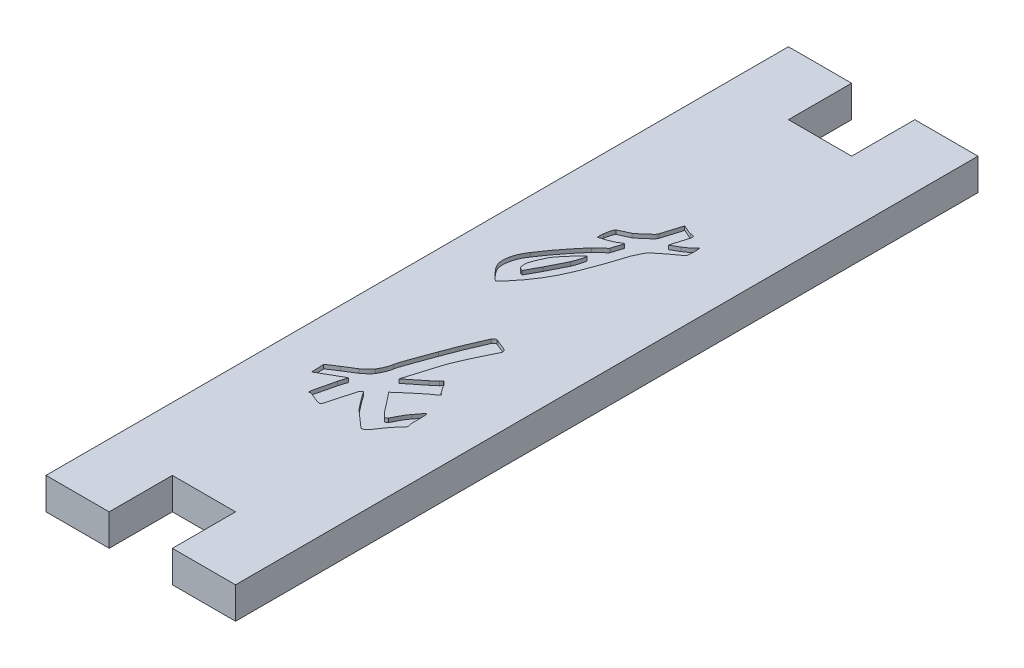
from build123d import *

# Parameters (mm, degrees)
EXTRUDE_1_DEPTH     = 4
CUT_EXTRUDE_1_DEPTH = 0.5


with BuildPart() as part:
    # 草圖1 → 填料-伸長1 (new body)
    with BuildSketch(Plane(origin=(0, 0, 0), x_dir=(1, 0, 0), z_dir=(0, 1, 0))):
        Polygon((-12, 47), (-12, -47), (-4, -47), (-4, -39), (4, -39), (4, -47), (12, -47), (12, 47), (4, 47), (4, 39), (-4, 39), (-4, 47), align=None)
    extrude(amount=EXTRUDE_1_DEPTH)

    # 草圖3 → 除料-伸長1 (cut)
    # profile 1 of 2: a face of its own
    with BuildSketch(Plane(origin=(0, 4, 0), x_dir=(1, 0, 0), z_dir=(0, 1, 0))):
        with BuildLine():
            add(Edge.make_bspline(
                [(-6.355501814, 4.359129383), (-6.396964695, 4.429641782), (-6.490705603, 4.589058979), (-6.607213892, 4.87628821), (-6.682323732, 5.240280014), (-6.686608044, 5.589572198), (-6.659611427, 5.899764075), (-6.613103157, 6.159630598), (-6.552451609, 6.438590561), (-6.468428857, 6.737134296), (-6.357637131, 7.056471783), (-6.197448135, 7.386617717), (-6.009152613, 7.740262462), (-5.857995764, 7.973302873), (-5.778718259, 8.095525998)],
                knots=[0, 0, 0, 0, 0.737570712, 1.667528793, 2.782379236, 4.070236944, 4.804167307, 5.589800716, 6.450142315, 7.379332046, 8.387006106, 9.495001798, 10.686199072, 12, 12, 12, 12], degree=3))
            add(Edge.make_bspline(
                [(-5.778718259, 8.095525998), (-5.614963707, 8.345918195), (-5.284236811, 8.851622817), (-4.756748484, 9.581410264), (-4.229891658, 10.274440351), (-3.802282785, 10.816175608), (-3.482573731, 11.212484586), (-3.259201189, 11.474774792), (-3.061985835, 11.720543896), (-2.877170248, 11.934111647), (-2.720280366, 12.121611227), (-2.589574808, 12.272839433), (-2.491294281, 12.388657066), (-2.437652714, 12.454594134), (-2.415961306, 12.481257557)],
                knots=[0, 0, 0, 0, 1.947119918, 3.932500911, 5.859217176, 7.613267125, 8.424533951, 9.173261026, 9.855497357, 10.475266734, 11.01138208, 11.446753545, 11.776279939, 12, 12, 12, 12], degree=3))
            add(Edge.make_bspline(
                [(-2.415961306, 12.481257557), (-2.375673558, 12.528002754), (-2.283400562, 12.635065557), (-2.111086984, 12.789836765), (-1.916511164, 12.958858232), (-1.718707164, 13.132049105), (-1.530781981, 13.294723678), (-1.368397809, 13.435913814), (-1.232778151, 13.541823636), (-1.201260404, 13.628733679), (-1.189842805, 13.660217654)],
                knots=[0, 0, 0, 0, 0.865178994, 1.981561663, 3.244134827, 4.482766419, 5.673521409, 6.720709703, 7.536565132, 8, 8, 8, 8], degree=3))
            add(Edge.make_bspline(
                [(-1.189842805, 13.660217654), (-1.178801259, 13.692814769), (-1.151929216, 13.772147048), (-1.110851983, 13.909196174), (-1.061598309, 14.072176342), (-1.012205552, 14.249481274), (-0.959481422, 14.426572001), (-0.904971769, 14.591590611), (-0.849019562, 14.72547937), (-0.823083673, 14.806394462), (-0.812575574, 14.839177751)],
                knots=[0, 0, 0, 0, 0.666986064, 1.62325791, 2.772553635, 3.966844816, 5.190213908, 6.353757644, 7.333013936, 8, 8, 8, 8], degree=3))
            add(Edge.make_bspline(
                [(-0.812575574, 14.839177751), (-0.800655951, 14.872439462), (-0.780708314, 14.928103344), (-0.767234849, 15.025221683), (-0.846806913, 15.043046994), (-0.932610841, 14.985166609), (-1.071759688, 14.906725782), (-1.178284056, 14.832079469), (-1.240628779, 14.788391778)],
                knots=[0, 0, 0, 0, 0.954507045, 1.597379236, 1.915548251, 2.736114477, 4.089770055, 6, 6, 6, 6], degree=3))
            add(Edge.make_bspline(
                [(-1.240628779, 14.788391778), (-1.327580877, 14.731628596), (-1.506171083, 14.615043161), (-1.802148162, 14.483408633), (-2.109435492, 14.372118835), (-2.405791492, 14.263409521), (-2.680379731, 14.17651472), (-2.910767377, 14.103183989), (-3.087990448, 14.056261978), (-3.183887737, 14.024483527), (-3.221281741, 14.012091898)],
                knots=[0, 0, 0, 0, 1.165451177, 2.39371069, 3.62804535, 4.840260365, 5.940495452, 6.864742646, 7.557319936, 8, 8, 8, 8], degree=3))
            add(Edge.make_bspline(
                [(-3.221281741, 14.012091898), (-3.22534503, 14.143989053), (-3.233333674, 14.403305985), (-3.208225891, 14.661515935), (-3.195888755, 14.788391778)],
                knots=[0, 0, 0, 0, 1.01726604, 2, 2, 2, 2], degree=3))
            add(Edge.make_bspline(
                [(-3.195888755, 14.788391778), (-3.177074742, 14.897349007), (-3.13932888, 15.115945898), (-3.074192657, 15.435897913), (-2.99026329, 15.737230253), (-2.890925619, 15.910785383), (-2.84401451, 15.992744861)],
                knots=[0, 0, 0, 0, 1.050103717, 2.106784545, 3.105950083, 4, 4, 4, 4], degree=3))
            Line((-2.84401451, 15.992744861), (-1.440145103, 16.645707376))
            add(Edge.make_bspline(
                [(-1.440145103, 16.645707376), (-1.387014209, 16.686917319), (-1.258206121, 16.786824805), (-1.03600765, 16.95451716), (-0.772139069, 17.159164741), (-0.49982224, 17.396656781), (-0.229031634, 17.636599328), (0.014427265, 17.868413205), (0.215397355, 18.077474031), (0.285876649, 18.233908803), (0.315598549, 18.299879081)],
                knots=[0, 0, 0, 0, 0.663792019, 1.609266752, 2.748404141, 3.959042503, 5.176430326, 6.316255543, 7.289946295, 8, 8, 8, 8], degree=3))
            add(Edge.make_bspline(
                [(0.315598549, 18.299879081), (0.325050002, 18.333803159), (0.346409026, 18.410467052), (0.387713096, 18.53664313), (0.434204695, 18.690792698), (0.512295263, 18.932418037), (0.618930546, 19.255254025), (0.737907516, 19.648410199), (0.855311078, 20.022846047), (0.94552102, 20.31282673), (1.005149303, 20.512612015), (1.03836806, 20.623344095), (1.057994607, 20.700857063), (1.064250583, 20.741202013), (1.066505441, 20.755743652)],
                knots=[0, 0, 0, 0, 0.493483248, 1.115206369, 1.86026494, 2.749904517, 4.67381163, 6.624917053, 8.506259925, 10.173295465, 10.880993075, 11.428019552, 11.793839554, 12, 12, 12, 12], degree=3))
            add(Edge.make_bspline(
                [(1.066505441, 20.755743652), (1.078394603, 20.764624321), (1.123491516, 20.798309688), (1.236800829, 20.721551605), (1.383100762, 20.67505288), (1.56203513, 20.588996971), (1.751209944, 20.502808464), (1.936868916, 20.40476984), (2.109745793, 20.328465436), (2.223228075, 20.312588747), (2.270858525, 20.30592503)],
                knots=[0, 0, 0, 0, 0.259029242, 0.982526738, 2.06748882, 3.260521251, 4.562127083, 5.903125012, 7.119905784, 8, 8, 8, 8], degree=3))
            add(Edge.make_bspline(
                [(2.270858525, 20.30592503), (2.307027401, 20.298908891), (2.381325741, 20.284496292), (2.495894074, 20.281269505), (2.60754941, 20.273850249), (2.708123952, 20.247672393), (2.792873311, 20.189554354), (2.833073243, 20.078147149), (2.825147792, 19.919523124), (2.791727394, 19.801004556), (2.77146312, 19.729141475)],
                knots=[0, 0, 0, 0, 0.876416554, 1.800340585, 2.726508788, 3.537985945, 4.258395915, 5.071917099, 6.224573051, 8, 8, 8, 8], degree=3))
            add(Edge.make_bspline(
                [(2.77146312, 19.729141475), (2.738216951, 19.631388811), (2.6675251, 19.423535785), (2.570805342, 19.09827322), (2.471393346, 18.760639468), (2.405059605, 18.534468476), (2.372430472, 18.423216445)],
                knots=[0, 0, 0, 0, 0.907183319, 1.928958154, 2.981268062, 4, 4, 4, 4], degree=3))
            add(Edge.make_bspline(
                [(2.372430472, 18.423216445), (2.338121909, 18.296032144), (2.267944258, 18.035878562), (2.188252887, 17.778478482), (2.147521161, 17.646916566)],
                knots=[0, 0, 0, 0, 0.977763209, 2, 2, 2, 2], degree=3))
            add(Edge.make_bspline(
                [(2.147521161, 17.646916566), (2.323575928, 17.743608954), (2.661240682, 17.929060403), (2.990935068, 18.12832834), (3.148730351, 18.223700121)],
                knots=[0, 0, 0, 0, 1.042778462, 2, 2, 2, 2], degree=3))
            add(Edge.make_bspline(
                [(3.148730351, 18.223700121), (3.279099193, 18.306896722), (3.532031814, 18.468309019), (3.827878365, 18.685784426), (4.041194803, 18.855328752), (4.169839866, 18.977646376), (4.275129682, 19.090159134), (4.328466604, 19.167464705), (4.353083434, 19.203143894)],
                knots=[0, 0, 0, 0, 1.781606563, 3.456549942, 4.229084896, 4.919048909, 5.501103773, 6, 6, 6, 6], degree=3))
            add(Edge.make_bspline(
                [(4.353083434, 19.203143894), (4.365584965, 19.226966086), (4.384919812, 19.263809451), (4.441194248, 19.316120282), (4.480751486, 19.253591234), (4.49918412, 19.138425127), (4.527846222, 18.916669042), (4.528014888, 18.616072783), (4.523019604, 18.283613598), (4.5045242, 18.01242126), (4.495477891, 17.818915499), (4.476010226, 17.719028044), (4.472755816, 17.654202047), (4.458613172, 17.628668963), (4.454655381, 17.621523579)],
                knots=[0, 0, 0, 0, 0.565973437, 0.875333592, 1.161042589, 1.702097804, 3.326650178, 5.415151342, 7.645979144, 9.832069873, 10.760150337, 11.431246737, 11.840835513, 12, 12, 12, 12], degree=3))
            add(Edge.make_bspline(
                [(4.454655381, 17.621523579), (4.227892611, 17.460376924), (3.78900439, 17.148485475), (3.357356414, 16.826650909), (3.148730351, 16.671100363)],
                knots=[0, 0, 0, 0, 1.033350906, 2, 2, 2, 2], degree=3))
            add(Edge.make_bspline(
                [(3.148730351, 16.671100363), (2.984829608, 16.547396061), (2.662950134, 16.304457104), (2.280417729, 15.996859971), (2.003015275, 15.7725801), (1.843084807, 15.631282794), (1.725014504, 15.517538078), (1.666987359, 15.445416041), (1.643288996, 15.415961306)],
                knots=[0, 0, 0, 0, 1.88241189, 3.696809041, 4.500195613, 5.151991927, 5.653672387, 6, 6, 6, 6], degree=3))
            add(Edge.make_bspline(
                [(1.643288996, 15.415961306), (1.567888193, 15.28800753), (1.406365118, 15.013905842), (1.284069825, 14.720123748), (1.218863362, 14.563482467)],
                knots=[0, 0, 0, 0, 0.933622674, 2, 2, 2, 2], degree=3))
            add(Edge.make_bspline(
                [(1.218863362, 14.563482467), (1.176651309, 14.473950261), (1.093845672, 14.298318637), (1.009774868, 14.12328913), (0.968561064, 14.037484885)],
                knots=[0, 0, 0, 0, 1.019545377, 2, 2, 2, 2], degree=3))
            add(Edge.make_bspline(
                [(0.968561064, 14.037484885), (0.849535813, 13.649931707), (0.609597883, 12.868679776), (0.346573374, 12.094893992), (0.214026602, 11.704957678)],
                knots=[0, 0, 0, 0, 0.992133686, 2, 2, 2, 2], degree=3))
            add(Edge.make_bspline(
                [(0.214026602, 11.704957678), (0.090993183, 11.356147322), (-0.165465463, 10.629064939), (-0.586767093, 9.531147171), (-1.02727134, 8.424166151), (-1.370786044, 7.712829738), (-1.53808948, 7.366384522)],
                knots=[0, 0, 0, 0, 0.94794649, 1.975959659, 3.014222975, 4, 4, 4, 4], degree=3))
            add(Edge.make_bspline(
                [(-1.53808948, 7.366384522), (-1.706491203, 7.043403536), (-2.035186776, 6.412991816), (-2.50249307, 5.674043667), (-2.878157375, 5.127060114), (-3.1445816, 4.751525298), (-3.402408942, 4.404780452), (-3.652005084, 4.092565304), (-3.884548983, 3.807649108), (-4.100042025, 3.556253816), (-4.297710464, 3.335420527), (-4.474764512, 3.150800648), (-4.62539466, 3.004800044), (-4.738038152, 2.897753476), (-4.815312887, 2.830715332), (-4.860685257, 2.809731918), (-4.875453446, 2.802902056)],
                knots=[0, 0, 0, 0, 2.68881243, 5.248169221, 6.44938883, 7.589130221, 8.648150866, 9.639668993, 10.540603059, 11.363847075, 12.084638577, 12.728789694, 13.252889179, 13.631939189, 13.880200399, 14, 14, 14, 14], degree=3))
            add(Edge.make_bspline(
                [(-4.875453446, 2.802902056), (-4.887759621, 2.806013638), (-4.919072047, 2.813930899), (-4.971174126, 2.848356063), (-5.043204711, 2.897877043), (-5.167730755, 2.9999646), (-5.345068535, 3.157591897), (-5.560553246, 3.383146756), (-5.778697744, 3.634841778), (-6.000920585, 3.883833782), (-6.195574389, 4.12455497), (-6.305599255, 4.285934536), (-6.355501814, 4.359129383)],
                knots=[0, 0, 0, 0, 0.17504993, 0.445405529, 0.854733877, 1.391531552, 2.673940756, 4.144260751, 5.712108071, 7.292545875, 8.772014955, 10, 10, 10, 10], degree=3))
        make_face()
        with BuildLine():
            add(Edge.make_bspline(
                [(-4.799274486, 6.891172914), (-4.819894294, 6.814240967), (-4.866008208, 6.642191199), (-4.851910432, 6.370106628), (-4.831119371, 6.121450713), (-4.808265312, 5.970940226), (-4.799274486, 5.911729141)],
                knots=[0, 0, 0, 0, 0.962255371, 2.151977407, 3.272984736, 4, 4, 4, 4], degree=3))
            add(Edge.make_bspline(
                [(-4.799274486, 5.911729141), (-4.796520444, 5.890182721), (-4.790636227, 5.844147173), (-4.731145793, 5.787996809), (-4.654163097, 5.730200661), (-4.586251523, 5.702193864), (-4.548972189, 5.686819831)],
                knots=[0, 0, 0, 0, 0.715582849, 1.528896597, 2.643514112, 4, 4, 4, 4], degree=3))
            add(Edge.make_bspline(
                [(-4.548972189, 5.686819831), (-4.513025553, 5.671340454), (-4.440097024, 5.639935896), (-4.363105239, 5.620497857), (-4.324062878, 5.610640871)],
                knots=[0, 0, 0, 0, 0.985804492, 2, 2, 2, 2], degree=3))
            add(Edge.make_bspline(
                [(-4.324062878, 5.610640871), (-4.160940342, 5.902670855), (-3.845329812, 6.467692345), (-3.54197277, 7.039384228), (-3.395405079, 7.315598549)],
                knots=[0, 0, 0, 0, 1.033695144, 2, 2, 2, 2], degree=3))
            add(Edge.make_bspline(
                [(-3.395405079, 7.315598549), (-3.277899134, 7.541606759), (-3.043638989, 7.992177294), (-2.757897716, 8.549454429), (-2.539525206, 8.967447546), (-2.40538467, 9.235953441), (-2.298747867, 9.456667935), (-2.241467453, 9.589917009), (-2.216444982, 9.648125756)],
                knots=[0, 0, 0, 0, 1.754062942, 3.496904271, 4.31247413, 5.001361206, 5.563752968, 6, 6, 6, 6], degree=3))
            add(Edge.make_bspline(
                [(-2.216444982, 9.648125756), (-2.17552934, 9.749311061), (-2.093896964, 9.951189767), (-1.990875365, 10.257095254), (-1.903786067, 10.549079328), (-1.830334109, 10.811553984), (-1.780396913, 11.026608125), (-1.764589444, 11.180698198), (-1.767781094, 11.260543983), (-1.776784264, 11.306397188), (-1.814437117, 11.303229237), (-1.829493392, 11.289416528), (-1.839177751, 11.280532044)],
                knots=[0, 0, 0, 0, 1.83182449, 3.654743716, 5.414181491, 6.950487494, 8.216427479, 9.153626695, 9.458762054, 9.658667296, 9.780451109, 10, 10, 10, 10], degree=3))
            add(Edge.make_bspline(
                [(-1.839177751, 11.280532044), (-1.996406467, 11.114905306), (-2.306156211, 10.788610969), (-2.615509659, 10.461940887), (-2.76783555, 10.301088271)],
                knots=[0, 0, 0, 0, 1.015198356, 2, 2, 2, 2], degree=3))
            add(Edge.make_bspline(
                [(-2.76783555, 10.301088271), (-2.892802155, 10.157551672), (-3.142308325, 9.87096897), (-3.444873217, 9.511018872), (-3.674563926, 9.232179281), (-3.820755428, 9.03466222), (-3.944525778, 8.850762012), (-4.015089066, 8.729498799), (-4.048367594, 8.672309553)],
                knots=[0, 0, 0, 0, 1.650635393, 3.295630195, 4.078577748, 4.783376484, 5.42622515, 6, 6, 6, 6], degree=3))
            add(Edge.make_bspline(
                [(-4.048367594, 8.672309553), (-4.141649227, 8.48729224), (-4.319884754, 8.133775079), (-4.501019958, 7.690568578), (-4.621598805, 7.373354236), (-4.687613528, 7.177436459), (-4.752248882, 7.023941721), (-4.785096514, 6.93120201), (-4.799274486, 6.891172914)],
                knots=[0, 0, 0, 0, 1.927158765, 3.682269964, 4.451279023, 5.084725128, 5.604941348, 6, 6, 6, 6], degree=3))
        make_face(mode=Mode.SUBTRACT)
    # profile 2 of 2: a face of its own
    with BuildSketch(Plane(origin=(0, 4, 0), x_dir=(1, 0, 0), z_dir=(0, 1, 0))):
        with BuildLine():
            add(Edge.make_bspline(
                [(5.5356711, -18.544135429), (5.547968059, -18.583804787), (5.572561976, -18.663143503), (5.540660015, -18.785615227), (5.480231433, -18.891841458), (5.401188216, -18.984003978), (5.311411449, -19.061392824), (5.234870389, -19.132193904), (5.16420893, -19.172065994), (5.143349561, -19.207472111), (5.136638452, -19.218863362)],
                knots=[0, 0, 0, 0, 1.162913968, 2.325827936, 3.467600938, 4.641701918, 5.764054703, 6.841019145, 7.627119745, 8, 8, 8, 8], degree=3))
            add(Edge.make_bspline(
                [(5.136638452, -19.218863362), (5.109966379, -19.273400582), (5.068167312, -19.358868439), (4.994129009, -19.45363307), (4.923007594, -19.50927839), (4.883443258, -19.548456921), (4.860943168, -19.570737606)],
                knots=[0, 0, 0, 0, 1.609408656, 2.522180417, 3.159569508, 4, 4, 4, 4], degree=3))
            add(Edge.make_bspline(
                [(4.860943168, -19.570737606), (4.836526315, -19.598354767), (4.771073581, -19.672386367), (4.661669147, -19.813998279), (4.513794317, -19.997121135), (4.353449121, -20.217061977), (4.181348807, -20.454611752), (4.005760738, -20.692934541), (3.850832457, -20.928806548), (3.753204476, -21.080942454), (3.707376058, -21.15235792)],
                knots=[0, 0, 0, 0, 0.451506836, 1.210326171, 2.191263523, 3.334877891, 4.543786826, 5.785380918, 6.960415991, 8, 8, 8, 8], degree=3))
            add(Edge.make_bspline(
                [(3.707376058, -21.15235792), (3.664949446, -21.216032211), (3.58344196, -21.338359477), (3.448236036, -21.502090077), (3.311299215, -21.642606403), (3.223688468, -21.732761258), (3.181378476, -21.776299879)],
                knots=[0, 0, 0, 0, 1.122012252, 2.155543287, 3.109253701, 4, 4, 4, 4], degree=3))
            add(Edge.make_bspline(
                [(3.181378476, -21.776299879), (3.139395139, -21.805923582), (3.056505768, -21.864410835), (2.955519884, -21.873423876), (2.905683192, -21.877871826)],
                knots=[0, 0, 0, 0, 1.012996879, 2, 2, 2, 2], degree=3))
            Line((2.905683192, -21.877871826), (2.778718259, -21.877871826))
            Line((2.778718259, -21.877871826), (2.753325272, -21.877871826))
            Line((2.753325272, -21.877871826), (0.598548972, -19.973397823))
            add(Edge.make_bspline(
                [(0.598548972, -19.973397823), (0.497896816, -19.8454482), (0.295411048, -19.588047079), (0.096438954, -19.327920248), (-0.00362757, -19.197097944)],
                knots=[0, 0, 0, 0, 0.994165241, 2, 2, 2, 2], degree=3))
            add(Edge.make_bspline(
                [(-0.00362757, -19.197097944), (-0.096763414, -19.076202165), (-0.286276374, -18.830203247), (-0.570482901, -18.460169693), (-0.837210787, -18.087888271), (-1.001973242, -17.837276878), (-1.081015719, -17.717049577)],
                knots=[0, 0, 0, 0, 1.000019621, 2.03484147, 3.057242749, 4, 4, 4, 4], degree=3))
            add(Edge.make_bspline(
                [(-1.081015719, -17.717049577), (-1.111819855, -17.739333276), (-1.170405624, -17.781714195), (-1.243870582, -17.851706714), (-1.312529193, -17.913950771), (-1.358872645, -17.949521), (-1.38210399, -17.967351874)],
                knots=[0, 0, 0, 0, 1.16286954, 2.211638249, 3.103518472, 4, 4, 4, 4], degree=3))
            add(Edge.make_bspline(
                [(-1.38210399, -17.967351874), (-1.42656344, -18.129461338), (-1.512537817, -18.442943856), (-1.641873188, -18.896604885), (-1.754758665, -19.321388846), (-1.867700848, -19.707173872), (-1.964866107, -20.048046249), (-2.043537533, -20.33528488), (-2.109245024, -20.562154685), (-2.146370993, -20.694058248), (-2.162031439, -20.749697703)],
                knots=[0, 0, 0, 0, 1.396127646, 2.699790612, 3.917983314, 5.046430062, 6.038304622, 6.861895486, 7.519925677, 8, 8, 8, 8], degree=3))
            add(Edge.make_bspline(
                [(-2.162031439, -20.749697703), (-2.177697532, -20.819836147), (-2.20691613, -20.950650324), (-2.248165907, -21.131795842), (-2.293305936, -21.282291317), (-2.34244848, -21.435242064), (-2.396014819, -21.582655231), (-2.44327492, -21.685821402), (-2.46311971, -21.729141475)],
                knots=[0, 0, 0, 0, 1.259596535, 2.349254917, 3.2545519, 4.011829459, 5.165155679, 6, 6, 6, 6], degree=3))
            add(Edge.make_bspline(
                [(-2.46311971, -21.729141475), (-2.480559371, -21.756535522), (-2.50518234, -21.795213037), (-2.54844344, -21.800229425), (-2.561064087, -21.801692866)],
                knots=[0, 0, 0, 0, 1.416536016, 2, 2, 2, 2], degree=3))
            Line((-2.561064087, -21.801692866), (-2.989117291, -21.703748489))
            Line((-2.989117291, -21.703748489), (-4.291414752, -21.177750907))
            add(Edge.make_bspline(
                [(-4.291414752, -21.177750907), (-4.313666134, -21.191920898), (-4.352788074, -21.216834298), (-4.398616911, -21.222476307), (-4.418379686, -21.224909311)],
                knots=[0, 0, 0, 0, 1.137539786, 2, 2, 2, 2], degree=3))
            add(Edge.make_bspline(
                [(-4.418379686, -21.224909311), (-4.433029564, -21.231603945), (-4.458852791, -21.243404524), (-4.497995747, -21.216606366), (-4.513090003, -21.165651097), (-4.515102175, -21.125782229), (-4.516324063, -21.101571947)],
                knots=[0, 0, 0, 0, 0.90117522, 1.588494505, 2.535618585, 4, 4, 4, 4], degree=3))
            add(Edge.make_bspline(
                [(-4.516324063, -21.101571947), (-4.515522053, -21.079765993), (-4.513505772, -21.02494502), (-4.49613994, -20.92854215), (-4.475552213, -20.799994025), (-4.428947285, -20.57963402), (-4.353440847, -20.263237196), (-4.253412058, -19.85230728), (-4.145207128, -19.417730419), (-4.042929388, -18.984704436), (-3.955814138, -18.591500219), (-3.894083948, -18.349337892), (-3.866989117, -18.243047158)],
                knots=[0, 0, 0, 0, 0.222969386, 0.56055326, 0.999752014, 1.555216767, 2.863258351, 4.327143902, 5.881004638, 7.443993973, 8.878108912, 10, 10, 10, 10], degree=3))
            add(Edge.make_bspline(
                [(-3.866989117, -18.243047158), (-3.845887631, -18.155832513), (-3.806156845, -17.991621029), (-3.740304563, -17.762808642), (-3.677588229, -17.565007436), (-3.606541428, -17.402224244), (-3.559598545, -17.288381906), (-3.528265186, -17.198832267), (-3.583274676, -17.150002724), (-3.618790512, -17.174794765), (-3.642079807, -17.191051995)],
                knots=[0, 0, 0, 0, 1.771781281, 3.335985984, 4.694880195, 5.88304353, 6.78297654, 7.262824691, 7.516601753, 8, 8, 8, 8], degree=3))
            add(Edge.make_bspline(
                [(-3.642079807, -17.191051995), (-3.666443913, -17.202811227), (-3.729866652, -17.23342194), (-3.84247263, -17.303847993), (-4.005691823, -17.389357234), (-4.280155049, -17.556570051), (-4.673950705, -17.782479554), (-4.999964744, -17.96862035), (-5.169286578, -18.065296252)],
                knots=[0, 0, 0, 0, 0.276542097, 0.719872805, 1.356520523, 2.160397529, 4.005826577, 6, 6, 6, 6], degree=3))
            add(Edge.make_bspline(
                [(-5.169286578, -18.065296252), (-5.387364832, -18.187897414), (-5.841183123, -18.443028994), (-6.289491928, -18.70772497), (-6.522370012, -18.8452237)],
                knots=[0, 0, 0, 0, 0.961081821, 2, 2, 2, 2], degree=3))
            Line((-6.522370012, -18.8452237), (-6.598548972, -17.238210399))
            Line((-6.598548972, -17.238210399), (-5.296251511, -16.38573156))
            add(Edge.make_bspline(
                [(-5.296251511, -16.38573156), (-5.13409652, -16.283153366), (-4.824519909, -16.087317212), (-4.454174141, -15.849345729), (-4.192496525, -15.692044044), (-4.052660504, -15.600263651), (-3.954486782, -15.546641086), (-3.908039573, -15.517637062), (-3.892382104, -15.507859734)],
                knots=[0, 0, 0, 0, 2.0858566, 3.982192661, 4.784768189, 5.404798569, 5.799356118, 6, 6, 6, 6], degree=3))
            add(Edge.make_bspline(
                [(-3.892382104, -15.507859734), (-3.867832472, -15.493886227), (-3.800540739, -15.455584168), (-3.692302041, -15.363192673), (-3.54849391, -15.246346981), (-3.386193445, -15.104955066), (-3.216513077, -14.950513133), (-3.053799022, -14.78879612), (-2.91556617, -14.633989628), (-2.843159455, -14.527858627), (-2.811366385, -14.481257557)],
                knots=[0, 0, 0, 0, 0.45170939, 1.23815736, 2.269705111, 3.422969904, 4.684049784, 5.943939404, 7.097204197, 8, 8, 8, 8], degree=3))
            add(Edge.make_bspline(
                [(-2.811366385, -14.481257557), (-2.747947276, -14.373321977), (-2.605269249, -14.130492392), (-2.420973951, -13.723536814), (-2.240085175, -13.285989285), (-2.187158053, -12.974813428), (-2.162031439, -12.827085852)],
                knots=[0, 0, 0, 0, 0.839335969, 1.888307862, 2.997495613, 4, 4, 4, 4], degree=3))
            add(Edge.make_bspline(
                [(-2.162031439, -12.827085852), (-2.143738828, -12.742172844), (-2.101020468, -12.543877238), (-1.998527639, -12.21251487), (-1.864135124, -11.7998095), (-1.688801092, -11.310029272), (-1.481739994, -10.741064278), (-1.246859026, -10.097875098), (-0.984247672, -9.381347445), (-0.802698827, -8.879155191), (-0.707376058, -8.61547763)],
                knots=[0, 0, 0, 0, 0.467424424, 1.091566666, 1.865580879, 2.804410134, 3.89169034, 5.125239899, 6.490598518, 8, 8, 8, 8], degree=3))
            add(Edge.make_bspline(
                [(-0.707376058, -8.61547763), (-0.606145347, -8.342075002), (-0.404714856, -7.798054071), (-0.101403137, -6.997236537), (0.203255771, -6.238188861), (0.453303628, -5.643408802), (0.6410282, -5.207523811), (0.76970346, -4.917372125), (0.881542042, -4.651769219), (0.981050637, -4.415619109), (1.067948187, -4.217048733), (1.13155011, -4.05931901), (1.181373012, -3.950417896), (1.211440974, -3.894715025), (1.222490931, -3.874244256)],
                knots=[0, 0, 0, 0, 2.049737906, 4.078601344, 6.020367629, 7.799782955, 8.614677093, 9.35703036, 10.031272703, 10.640770667, 11.158728833, 11.555025631, 11.836472212, 12, 12, 12, 12], degree=3))
            add(Edge.make_bspline(
                [(1.222490931, -3.874244256), (1.248243673, -3.825358212), (1.303570743, -3.720331662), (1.459233746, -3.620719307), (1.645253116, -3.553812466), (1.765712214, -3.600897524), (1.824667473, -3.623941959)],
                knots=[0, 0, 0, 0, 0.898258521, 1.92981443, 2.986806902, 4, 4, 4, 4], degree=3))
            add(Edge.make_bspline(
                [(1.824667473, -3.623941959), (1.860608156, -3.643981174), (1.949159094, -3.693353951), (2.11244769, -3.756783368), (2.309636897, -3.824291055), (2.513630872, -3.916570064), (2.722247687, -3.99568522), (2.918213804, -4.076169935), (3.09461776, -4.13631), (3.188252627, -4.199103177), (3.22853688, -4.226118501)],
                knots=[0, 0, 0, 0, 0.644842042, 1.588766916, 2.740860108, 3.913838866, 5.097198169, 6.238311325, 7.24207386, 8, 8, 8, 8], degree=3))
            add(Edge.make_bspline(
                [(3.22853688, -4.226118501), (3.273882824, -4.271386415), (3.364366861, -4.36171475), (3.375393931, -4.489068937), (3.3808948, -4.552599758)],
                knots=[0, 0, 0, 0, 1.002297102, 2, 2, 2, 2], degree=3))
            add(Edge.make_bspline(
                [(3.3808948, -4.552599758), (3.379532187, -4.587027712), (3.376758839, -4.657099471), (3.345837674, -4.720079611), (3.330108827, -4.752116082)],
                knots=[0, 0, 0, 0, 0.98264846, 2, 2, 2, 2], degree=3))
            add(Edge.make_bspline(
                [(3.330108827, -4.752116082), (3.1591586, -5.089877312), (2.823088772, -5.753879695), (2.506307634, -6.427295718), (2.350665054, -6.758162031)],
                knots=[0, 0, 0, 0, 1.01734945, 2, 2, 2, 2], degree=3))
            add(Edge.make_bspline(
                [(2.350665054, -6.758162031), (2.218725671, -7.03807776), (1.950572428, -7.606977722), (1.637334877, -8.325148035), (1.398854771, -8.895189357), (1.243036894, -9.295217854), (1.112219759, -9.667376214), (1.034647583, -9.905544272), (0.99758162, -10.019347037)],
                knots=[0, 0, 0, 0, 1.576332837, 3.203734555, 3.990768844, 4.724018696, 5.390303625, 6, 6, 6, 6], degree=3))
            add(Edge.make_bspline(
                [(0.99758162, -10.019347037), (0.968448362, -10.114838997), (0.902476288, -10.331079919), (0.79509321, -10.69343148), (0.660296072, -11.128578221), (0.50179034, -11.629600519), (0.329841235, -12.182978935), (0.152169582, -12.778662955), (-0.035846491, -13.406055147), (-0.163364039, -13.836722494), (-0.22853688, -14.056831923)],
                knots=[0, 0, 0, 0, 0.567844153, 1.285879394, 2.14952305, 3.15881087, 4.274773607, 5.445368859, 6.694355625, 8, 8, 8, 8], degree=3))
            add(Edge.make_bspline(
                [(-0.22853688, -14.056831923), (-0.147381499, -13.991707441), (0.028928238, -13.850224767), (0.303318166, -13.623710318), (0.596346205, -13.383303044), (0.893298817, -13.143221692), (1.184872859, -12.916989042), (1.447945505, -12.699022966), (1.675552873, -12.518666795), (1.815938132, -12.416817804), (1.875453446, -12.373639661)],
                knots=[0, 0, 0, 0, 0.926740373, 2.013339722, 3.168892548, 4.302507151, 5.414272245, 6.455410586, 7.345182501, 8, 8, 8, 8], degree=3))
            add(Edge.make_bspline(
                [(1.875453446, -12.373639661), (1.941133162, -12.32333156), (2.072947131, -12.222367199), (2.259209988, -12.066042658), (2.430160754, -11.918989671), (2.532428193, -11.820250649), (2.579201935, -11.775090689)],
                knots=[0, 0, 0, 0, 1.073804967, 2.1550412, 3.156176913, 4, 4, 4, 4], degree=3))
            add(Edge.make_bspline(
                [(2.579201935, -11.775090689), (2.626368394, -11.725312253), (2.716338669, -11.630359616), (2.793021829, -11.524408975), (2.829504232, -11.474002418)],
                knots=[0, 0, 0, 0, 1.048489813, 2, 2, 2, 2], degree=3))
            add(Edge.make_bspline(
                [(2.829504232, -11.474002418), (2.857636614, -11.491684744), (2.917939605, -11.529587582), (2.973817613, -11.573769493), (3.00362757, -11.597339782)],
                knots=[0, 0, 0, 0, 0.933034374, 2, 2, 2, 2], degree=3))
            add(Edge.make_bspline(
                [(3.00362757, -11.597339782), (3.067262445, -11.651419603), (3.195471209, -11.760377261), (3.285011021, -11.90284927), (3.330108827, -11.974607013)],
                knots=[0, 0, 0, 0, 0.992675899, 2, 2, 2, 2], degree=3))
            add(Edge.make_bspline(
                [(3.330108827, -11.974607013), (3.377686217, -12.067663532), (3.475999637, -12.259954543), (3.630624378, -12.48137064), (3.760084845, -12.644242177), (3.836590091, -12.749344839), (3.891837132, -12.833187466), (3.920361578, -12.882606616), (3.932285369, -12.903264813)],
                knots=[0, 0, 0, 0, 1.695252458, 3.503051855, 4.370841755, 5.073746255, 5.612807344, 6, 6, 6, 6], degree=3))
            add(Edge.make_bspline(
                [(3.932285369, -12.903264813), (3.951036105, -12.9244879), (4.001914575, -12.982074877), (4.065964023, -13.024932363), (4.106408706, -13.051995163)],
                knots=[0, 0, 0, 0, 0.737079436, 2, 2, 2, 2], degree=3))
            add(Edge.make_bspline(
                [(4.106408706, -13.051995163), (4.12918824, -13.066832463), (4.170576391, -13.093790362), (4.213896425, -13.117509645), (4.23337364, -13.128174123)],
                knots=[0, 0, 0, 0, 1.100775631, 2, 2, 2, 2], degree=3))
            add(Edge.make_bspline(
                [(4.23337364, -13.128174123), (4.177106583, -13.183201713), (4.071217484, -13.286758257), (3.959326871, -13.383790756), (3.906892382, -13.429262394)],
                knots=[0, 0, 0, 0, 1.062754469, 2, 2, 2, 2], degree=3))
            add(Edge.make_bspline(
                [(3.906892382, -13.429262394), (3.862722065, -13.469831213), (3.770260829, -13.554753472), (3.624364177, -13.665942767), (3.484021511, -13.757936244), (3.394454318, -13.806970285), (3.355501814, -13.828295042)],
                knots=[0, 0, 0, 0, 1.053711799, 2.205723258, 3.219674409, 4, 4, 4, 4], degree=3))
            add(Edge.make_bspline(
                [(3.355501814, -13.828295042), (3.342030923, -13.83651887), (3.305000127, -13.859125754), (3.240152605, -13.913962678), (3.142105047, -13.986839277), (2.968232723, -14.134145568), (2.698876078, -14.352756504), (2.334509161, -14.657066459), (1.923631028, -15.006832944), (1.483727636, -15.388205661), (1.026055695, -15.781383384), (0.723868826, -16.051498085), (0.573155985, -16.186215236)],
                knots=[0, 0, 0, 0, 0.129653802, 0.356411725, 0.696548609, 1.134536055, 2.22950467, 3.54981079, 5.038257435, 6.666918308, 8.337657054, 10, 10, 10, 10], degree=3))
            add(Edge.make_bspline(
                [(0.573155985, -16.186215236), (0.701681981, -16.340700274), (0.948450457, -16.637309821), (1.299877626, -17.07114501), (1.613738675, -17.478018858), (1.890398551, -17.857599542), (2.144639158, -18.193498109), (2.369510066, -18.489998793), (2.581387391, -18.732648494), (2.716692946, -18.876997269), (2.778718259, -18.943168077)],
                knots=[0, 0, 0, 0, 1.365394258, 2.621541716, 3.793198352, 4.856334319, 5.812646872, 6.655710631, 7.383765372, 8, 8, 8, 8], degree=3))
            add(Edge.make_bspline(
                [(2.778718259, -18.943168077), (2.790684202, -18.955390927), (2.82183301, -18.987208494), (2.884858184, -19.041719539), (2.975025686, -19.111925), (3.042437055, -19.166721513), (3.07980653, -19.197097944)],
                knots=[0, 0, 0, 0, 0.520630382, 1.355264377, 2.533891533, 4, 4, 4, 4], degree=3))
            add(Edge.make_bspline(
                [(3.07980653, -19.197097944), (3.115091004, -19.195143664), (3.182532553, -19.191408318), (3.277484633, -19.159187903), (3.352331468, -19.097615044), (3.388121548, -19.045698637), (3.406287787, -19.019347037)],
                knots=[0, 0, 0, 0, 1.082425029, 2.068910547, 3.019822448, 4, 4, 4, 4], degree=3))
            add(Edge.make_bspline(
                [(3.406287787, -19.019347037), (3.478595607, -18.886813222), (3.638466542, -18.593783991), (3.869508102, -18.118055289), (4.135510276, -17.617370645), (4.369347878, -17.313988727), (4.483675937, -17.165659008)],
                knots=[0, 0, 0, 0, 0.843089258, 1.864051054, 2.955690209, 4, 4, 4, 4], degree=3))
            add(Edge.make_bspline(
                [(4.483675937, -17.165659008), (4.539715493, -17.097062738), (4.65038235, -16.961598895), (4.806082974, -16.756584919), (4.941105903, -16.557701049), (5.061994644, -16.386449973), (5.16310355, -16.250152411), (5.229333122, -16.161127046), (5.310163109, -16.103931662), (5.344198012, -16.14161345), (5.361547763, -16.160822249)],
                knots=[0, 0, 0, 0, 1.512990255, 2.987851567, 4.397479142, 5.612515621, 6.587525152, 7.246261677, 7.615771728, 8, 8, 8, 8], degree=3))
            add(Edge.make_bspline(
                [(5.361547763, -16.160822249), (5.369385861, -16.182428757), (5.388161469, -16.234185615), (5.40367647, -16.330914366), (5.418674597, -16.455430536), (5.425123142, -16.666315501), (5.436560653, -16.959966673), (5.437015411, -17.328922504), (5.44168797, -17.701339385), (5.443607339, -18.001377735), (5.456956576, -18.220615373), (5.474636643, -18.35387452), (5.496751639, -18.461228845), (5.523897835, -18.519055915), (5.5356711, -18.544135429)],
                knots=[0, 0, 0, 0, 0.343975019, 0.823967751, 1.462615732, 2.224899694, 3.984260836, 5.869771823, 7.75528281, 9.568552885, 10.368084158, 11.044956922, 11.585799228, 12, 12, 12, 12], degree=3))
        make_face()
    extrude(amount=-CUT_EXTRUDE_1_DEPTH, mode=Mode.SUBTRACT)


solid = part.part
